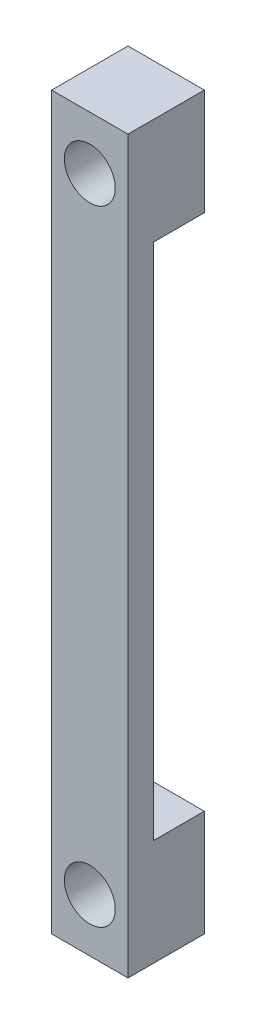
from build123d import *

# Parameters (mm, degrees)
SKETCH1_W           = 9
SKETCH1_H           = 86.14
BOSS_EXTRUDE1_DEPTH = 3
SKETCH2_R           = 3
BOSS_EXTRUDE2_DEPTH = 6
SKETCH2_3_R         = 3
CUT_EXTRUDE1_DEPTH  = 49.243126486


with BuildPart() as part:
    # Sketch1 → Boss-Extrude1 (new body)
    with BuildSketch(Plane.XY):
        with Locations((0.802799371, -4.503937949)):
            Rectangle(SKETCH1_W, SKETCH1_H)
    extrude(amount=BOSS_EXTRUDE1_DEPTH)

    # Sketch2 → Boss-Extrude2 (add)
    # profile 1 of 2: a face of its own
    with BuildSketch(Plane(origin=(0, 0, 0), x_dir=(-1, 0, 0), z_dir=(0, 0, -1))):
        Polygon((-0.802799371, 38.566062051), (-5.302799371, 38.566062051), (-5.302799371, 26.041062051), (3.697200629, 26.041062051), (3.697200629, 38.566062051), align=None)
        with Locations((-0.802799371, 32.303562051)):
            Circle(SKETCH2_R, mode=Mode.SUBTRACT)
    # profile 2 of 2: a face of its own
    with BuildSketch(Plane(origin=(0, 0, 0), x_dir=(-1, 0, 0), z_dir=(0, 0, -1))):
        Polygon((3.697200629, -35.048937949), (-5.302799371, -35.048937949), (-5.302799371, -47.573937949), (-0.802799371, -47.573937949), (3.697200629, -47.573937949), align=None)
        with Locations((-0.802799371, -41.311437949)):
            Circle(SKETCH2_R, mode=Mode.SUBTRACT)
    extrude(amount=BOSS_EXTRUDE2_DEPTH)

    # Sketch2<3> → Cut-Extrude1 (cut, through all)
    with BuildSketch(Plane(origin=(0, 0, 0), x_dir=(-1, 0, 0), z_dir=(0, 0, -1))):
        with Locations((-0.802799371, 32.303562051)):
            Circle(SKETCH2_3_R)
        with Locations((-0.802799371, -41.311437949)):
            Circle(SKETCH2_3_R)
    extrude(amount=-CUT_EXTRUDE1_DEPTH, mode=Mode.SUBTRACT)


solid = part.part
